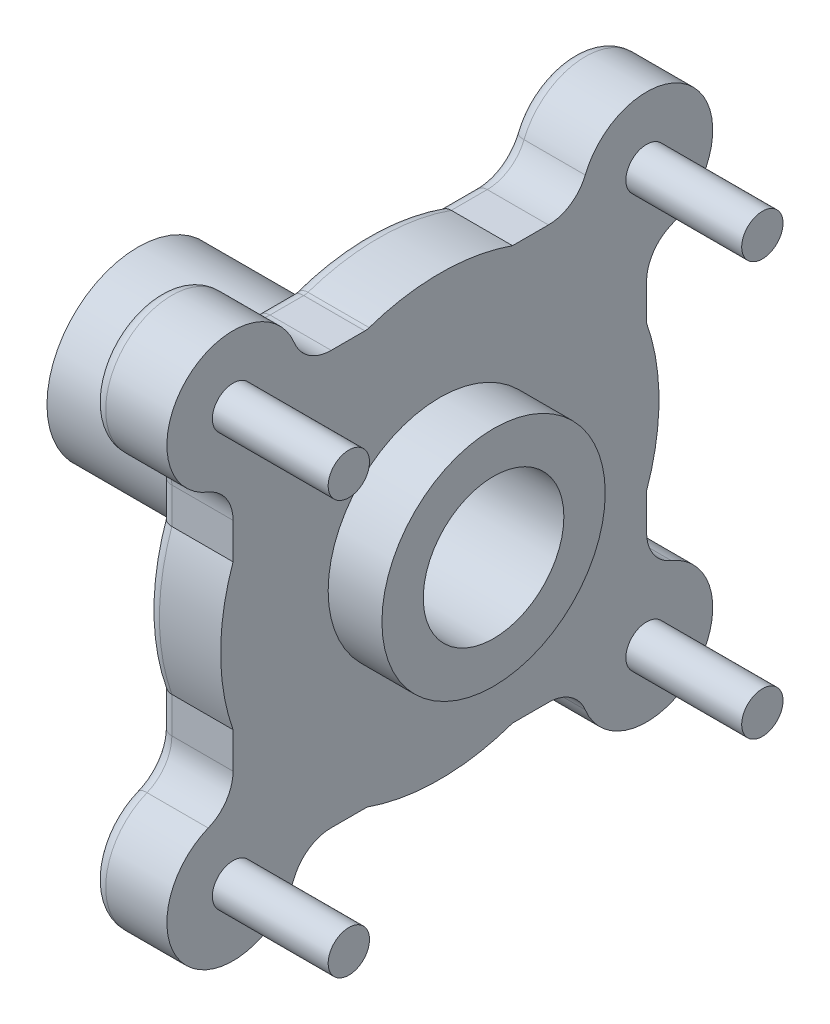
from build123d import *
from build123d.topology import SkipClean

# Parameters (mm, degrees)
EXTRUDE1_DEPTH             = 7.14375
EXTRUDE1_DEPTH_BACK        = 7.14375
SKETCH1_R                  = 42.06875
EXTRUDE2_DEPTH             = 17.4625
EXTRUDE2_DEPTH_BACK        = 17.4625
SKETCH3_R                  = 21.43125
SKETCH4_R                  = 17.4625
EXTRUDE3_DEPTH             = 33.3375
EXTRUDE4_REACH             = 80.232
SKETCH5_R                  = 12.7
EXTRUDE4_DIRECTION_2_REACH = 80.232
EXTRUDE5_START             = -7.14375
SKETCH6_W                  = 79.375
SKETCH6_H                  = 79.375
EXTRUDE5_DEPTH             = 14.2875
FILLET1_R                  = 7.62
SKETCH7_R                  = 13.49375
EXTRUDE6_DEPTH             = 101.740603625
SKETCH8_R                  = 3.96875
EXTRUDE7_DEPTH             = 22.225
FILLET2_R                  = 2.54
FILLET3_R                  = 2.54
FILLET4_R                  = 2.54
FILLET5_R                  = 2.54
FILLET6_R                  = 2.54
FILLET7_R                  = 2.54
FILLET8_R                  = 2.54
FILLET9_R                  = 2.54
FILLET10_R                 = 2.54
FILLET11_R                 = 2.54


with BuildPart() as part:
    # Sketch1 → Extrude1 (new, two sides: drawn at the far end of the back side and taken through both)
    with BuildSketch(Plane(origin=(0, 0, 0), x_dir=(0, 0, -1), z_dir=(1, 0, 0)).offset(-EXTRUDE1_DEPTH_BACK)):
        Circle(SKETCH1_R)
    extrude(amount=EXTRUDE1_DEPTH + EXTRUDE1_DEPTH_BACK)

    # Sketch3 → Extrude2 (add, two sides: drawn at the far end of the back side and taken through both)
    with BuildSketch(Plane(origin=(0, 0, 0), x_dir=(0, 0, -1), z_dir=(1, 0, 0)).offset(-EXTRUDE2_DEPTH_BACK)):
        Circle(SKETCH3_R)
    extrude(amount=EXTRUDE2_DEPTH + EXTRUDE2_DEPTH_BACK)

    # Sketch4 → Extrude3 (add)
    with BuildSketch(Plane.ZY.offset(17.4625)):
        with Locations(Location((0, 0, 0), (0, 0, 180))):
            Circle(SKETCH4_R)
    extrude(amount=EXTRUDE3_DEPTH)


with BuildPart() as body_2:

    # Extrude4: up to this face of the body (flat: up to its plane)
    extrude4_end = Plane(part.part.faces().sort_by_distance((7.14375, 0, 40.878866064))[0])
    # Sketch5 → Extrude4 (new, up to the picked face)
    with BuildSketch(Plane(origin=(0, 0, 0), x_dir=(0, 0, -1), z_dir=(1, 0, 0)), mode=Mode.PRIVATE) as extrude4_sk1:
        with Locations((-39.6875, 39.6875)):
            Circle(SKETCH5_R)
    extrude4_tool1 = split(extrude(extrude4_sk1.sketch, amount=EXTRUDE4_REACH, mode=Mode.PRIVATE), bisect_by=extrude4_end, keep=Keep.BOTH, mode=Mode.PRIVATE)
    # Sketch5 → Extrude4 (new, up to the picked face)
    with BuildSketch(Plane(origin=(0, 0, 0), x_dir=(0, 0, -1), z_dir=(1, 0, 0)), mode=Mode.PRIVATE) as extrude4_sk2:
        with Locations((-39.6875, -39.6875)):
            Circle(SKETCH5_R)
    extrude4_tool2 = split(extrude(extrude4_sk2.sketch, amount=EXTRUDE4_REACH, mode=Mode.PRIVATE), bisect_by=extrude4_end, keep=Keep.BOTH, mode=Mode.PRIVATE)
    # Sketch5 → Extrude4 (new, up to the picked face)
    with BuildSketch(Plane(origin=(0, 0, 0), x_dir=(0, 0, -1), z_dir=(1, 0, 0)), mode=Mode.PRIVATE) as extrude4_sk3:
        with Locations((39.6875, -39.6875)):
            Circle(SKETCH5_R)
    extrude4_tool3 = split(extrude(extrude4_sk3.sketch, amount=EXTRUDE4_REACH, mode=Mode.PRIVATE), bisect_by=extrude4_end, keep=Keep.BOTH, mode=Mode.PRIVATE)
    # Sketch5 → Extrude4 (new, up to the picked face)
    with BuildSketch(Plane(origin=(0, 0, 0), x_dir=(0, 0, -1), z_dir=(1, 0, 0)), mode=Mode.PRIVATE) as extrude4_sk4:
        with Locations((39.6875, 39.6875)):
            Circle(SKETCH5_R)
    extrude4_tool4 = split(extrude(extrude4_sk4.sketch, amount=EXTRUDE4_REACH, mode=Mode.PRIVATE), bisect_by=extrude4_end, keep=Keep.BOTH, mode=Mode.PRIVATE)
    add(extrude4_tool1.solids().sort_by(Axis((0, 39.6875, 39.6875), (1, 0, 0)))[0])
    add(extrude4_tool2.solids().sort_by(Axis((0, -39.6875, 39.6875), (1, 0, 0)))[0])
    add(extrude4_tool3.solids().sort_by(Axis((0, -39.6875, -39.6875), (1, 0, 0)))[0])
    add(extrude4_tool4.solids().sort_by(Axis((0, 39.6875, -39.6875), (1, 0, 0)))[0])


    # Extrude4 direction 2: up to this face of the body (flat: up to its plane)
    extrude4_direction_2_end = Plane(part.part.faces().sort_by_distance((-7.14375, 0, 40.878866064))[0])
    # Sketch5 → Extrude4 direction 2 (add, up to the picked face)
    with BuildSketch(Plane(origin=(0, 0, 0), x_dir=(0, 0, -1), z_dir=(1, 0, 0)), mode=Mode.PRIVATE) as extrude4_direction_2_sk1:
        with Locations((-39.6875, 39.6875)):
            Circle(SKETCH5_R)
    extrude4_direction_2_tool1 = split(extrude(extrude4_direction_2_sk1.sketch, amount=-EXTRUDE4_DIRECTION_2_REACH, mode=Mode.PRIVATE), bisect_by=extrude4_direction_2_end, keep=Keep.BOTH, mode=Mode.PRIVATE)
    # Sketch5 → Extrude4 direction 2 (add, up to the picked face)
    with BuildSketch(Plane(origin=(0, 0, 0), x_dir=(0, 0, -1), z_dir=(1, 0, 0)), mode=Mode.PRIVATE) as extrude4_direction_2_sk2:
        with Locations((-39.6875, -39.6875)):
            Circle(SKETCH5_R)
    extrude4_direction_2_tool2 = split(extrude(extrude4_direction_2_sk2.sketch, amount=-EXTRUDE4_DIRECTION_2_REACH, mode=Mode.PRIVATE), bisect_by=extrude4_direction_2_end, keep=Keep.BOTH, mode=Mode.PRIVATE)
    # Sketch5 → Extrude4 direction 2 (add, up to the picked face)
    with BuildSketch(Plane(origin=(0, 0, 0), x_dir=(0, 0, -1), z_dir=(1, 0, 0)), mode=Mode.PRIVATE) as extrude4_direction_2_sk3:
        with Locations((39.6875, -39.6875)):
            Circle(SKETCH5_R)
    extrude4_direction_2_tool3 = split(extrude(extrude4_direction_2_sk3.sketch, amount=-EXTRUDE4_DIRECTION_2_REACH, mode=Mode.PRIVATE), bisect_by=extrude4_direction_2_end, keep=Keep.BOTH, mode=Mode.PRIVATE)
    # Sketch5 → Extrude4 direction 2 (add, up to the picked face)
    with BuildSketch(Plane(origin=(0, 0, 0), x_dir=(0, 0, -1), z_dir=(1, 0, 0)), mode=Mode.PRIVATE) as extrude4_direction_2_sk4:
        with Locations((39.6875, 39.6875)):
            Circle(SKETCH5_R)
    extrude4_direction_2_tool4 = split(extrude(extrude4_direction_2_sk4.sketch, amount=-EXTRUDE4_DIRECTION_2_REACH, mode=Mode.PRIVATE), bisect_by=extrude4_direction_2_end, keep=Keep.BOTH, mode=Mode.PRIVATE)
    add(extrude4_direction_2_tool1.solids().sort_by(Axis((0, 39.6875, 39.6875), (-1, 0, 0)))[0])
    add(extrude4_direction_2_tool2.solids().sort_by(Axis((0, -39.6875, 39.6875), (-1, 0, 0)))[0])
    add(extrude4_direction_2_tool3.solids().sort_by(Axis((0, -39.6875, -39.6875), (-1, 0, 0)))[0])
    add(extrude4_direction_2_tool4.solids().sort_by(Axis((0, 39.6875, -39.6875), (-1, 0, 0)))[0])


with BuildPart() as part_1:
    with SkipClean():  # the faces are left unmerged after this step: merging them gives an invalid solid
        add(part.part)

        add(body_2.part)  # Extrude5 merges body 2
        # Sketch6 → Extrude5 (add)
        with BuildSketch(Plane(origin=(0, 0, 0), x_dir=(0, 0, -1), z_dir=(1, 0, 0)).offset(EXTRUDE5_START)):
            Rectangle(SKETCH6_W, SKETCH6_H)
        extrude(amount=EXTRUDE5_DEPTH)
    add(part_1.part.scale(1), mode=Mode.REPLACE)  # the faces are merged on a copy

    # Fillet1
    fillet1_edges = [part_1.edges().sort_by_distance(p)[0] for p in [
        (0, 26.9875, 39.6875),
        (0, 39.6875, 26.9875),
        (0, -26.9875, 39.6875),
        (0, -39.6875, 26.9875),
        (0, -39.6875, -26.9875),
        (0, -26.9875, -39.6875),
        (0, 26.9875, -39.6875),
        (0, 39.6875, -26.9875),
    ]]
    fillet(fillet1_edges, radius=FILLET1_R)

    # Sketch7 → Extrude6 (cut, through all)
    with BuildSketch(Plane(origin=(17.4625, 0, 0), x_dir=(0, 0, -1), z_dir=(1, 0, 0))):
        Circle(SKETCH7_R)
    extrude(amount=-EXTRUDE6_DEPTH, mode=Mode.SUBTRACT)

    # Sketch8 → Extrude7 (add)
    with BuildSketch(Plane(origin=(7.14375, 0, 0), x_dir=(0, 0, -1), z_dir=(1, 0, 0))):
        with Locations((39.6875, 39.6875)):
            Circle(SKETCH8_R)
        with Locations((-39.6875, 39.6875)):
            Circle(SKETCH8_R)
        with Locations((-39.6875, -39.6875)):
            Circle(SKETCH8_R)
        with Locations((39.6875, -39.6875)):
            Circle(SKETCH8_R)
    extrude(amount=EXTRUDE7_DEPTH)

    # Fillet2
    fillet2_edges = [part_1.edges().sort_by_distance(p)[0] for p in [
        (-7.14375, 48.667756121, 48.667756121),
        (-7.14375, 39.6875, 17.401603767),
        (-7.14375, 40.989329774, 25.11006534),
        (-7.14375, 25.11006534, 40.989329774),
        (-7.14375, 17.401603767, 39.6875),
    ]]
    fillet(fillet2_edges, radius=FILLET2_R)

    # Fillet3
    fillet3_edges = [part_1.edges().sort_by_distance(p)[0] for p in [
        (-7.14375, -48.667756121, 48.667756121),
        (-7.14375, -17.401603767, 39.6875),
        (-7.14375, -40.989329774, 25.11006534),
        (-7.14375, -25.11006534, 40.989329774),
        (-7.14375, -39.6875, 17.401603767),
    ]]
    fillet(fillet3_edges, radius=FILLET3_R)

    # Fillet4
    fillet4_edges = [part_1.edges().sort_by_distance(p)[0] for p in [
        (-7.14375, 48.667756121, -48.667756121),
        (-7.14375, 17.401603767, -39.6875),
        (-7.14375, 25.11006534, -40.989329774),
        (-7.14375, 40.989329774, -25.11006534),
        (-7.14375, 39.6875, -17.401603767),
    ]]
    fillet(fillet4_edges, radius=FILLET4_R)

    # Fillet5
    fillet5_edges = [part_1.edges().sort_by_distance(p)[0] for p in [
        (-7.14375, -39.6875, -17.401603767),
        (-7.14375, -25.11006534, -40.989329774),
        (-7.14375, -40.989329774, -25.11006534),
        (-7.14375, -17.401603767, -39.6875),
        (-7.14375, -48.667756121, -48.667756121),
    ]]
    fillet(fillet5_edges, radius=FILLET5_R)

    # Fillet6
    fillet6_edges = [part_1.edges().sort_by_distance(p)[0] for p in [
        (-7.14375, 0, -42.06875),
    ]]
    fillet(fillet6_edges, radius=FILLET6_R)

    # Fillet7
    fillet7_edges = [part_1.edges().sort_by_distance(p)[0] for p in [
        (-7.14375, -42.06875, 0),
    ]]
    fillet(fillet7_edges, radius=FILLET7_R)

    # Fillet8
    fillet8_edges = [part_1.edges().sort_by_distance(p)[0] for p in [
        (-7.14375, 0, 42.06875),
    ]]
    fillet(fillet8_edges, radius=FILLET8_R)

    # Fillet9
    fillet9_edges = [part_1.edges().sort_by_distance(p)[0] for p in [
        (-7.14375, 42.06875, 0),
    ]]
    fillet(fillet9_edges, radius=FILLET9_R)

    # Fillet10
    fillet10_edges = [part_1.edges().sort_by_distance(p)[0] for p in [
        (-7.14375, 0, 21.43125),
    ]]
    fillet(fillet10_edges, radius=FILLET10_R)

    # Fillet11
    fillet11_edges = [part_1.edges().sort_by_distance(p)[0] for p in [
        (1.27, 39.6875, 13.952851691),
        (-6.40656867, 38.936758181, 13.824133333),
    ]]
    fillet(fillet11_edges, radius=FILLET11_R)


solid = part_1.part
